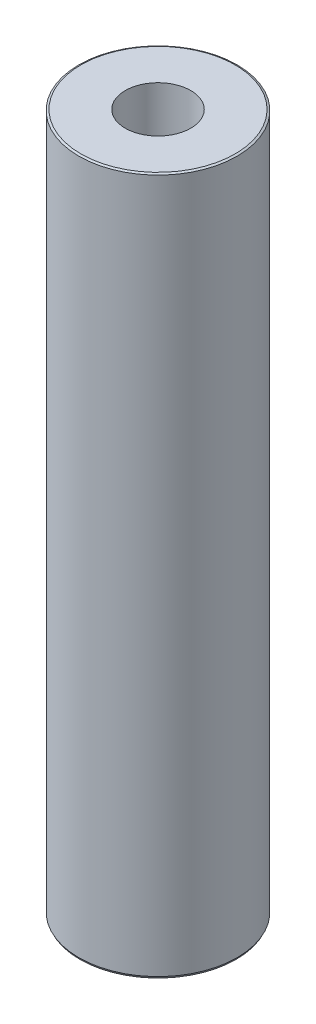
from build123d import *
from OCP.BRepFilletAPI import BRepFilletAPI_MakeChamfer

# Parameters (mm, degrees)
SKETCH1_R           = 45
BOSS_EXTRUDE1_DEPTH = 396.360686705
SKETCH2_R           = 18.602902704
CUT_EXTRUDE1_DEPTH  = 402.437160668
CHAMFER1_SIZE       = 0.553554295
CHAMFER1_SIZE2      = 1.134235657


with BuildPart() as part:
    # Sketch1 → Boss-Extrude1 (new body)
    with BuildSketch(Plane(origin=(0, 0, 0), x_dir=(1, 0, 0), z_dir=(0, 1, 0))):
        Circle(SKETCH1_R)
    extrude(amount=BOSS_EXTRUDE1_DEPTH)

    # Sketch2 → Cut-Extrude1 (cut, through all)
    with BuildSketch(Plane(origin=(0, 0, 0), x_dir=(1, 0, 0), z_dir=(0, 1, 0))):
        Circle(SKETCH2_R)
    extrude(amount=CUT_EXTRUDE1_DEPTH, mode=Mode.SUBTRACT)

    # Chamfer1: one chamfer whose edges measure the first distance from different faces: ONE call of the kernel's chamfer builder (chamfer() names one face for all edges)
    chamfer1_edges_1 = [part.edges().sort_by_distance(p)[0] for p in [
        (-45, 396.360686705, 0),
    ]]
    chamfer1_side_1 = [part.faces().sort_by_distance(p)[0] for p in [
        (-45, 198.180343353, 0),
    ]]
    chamfer1_edges_2 = [part.edges().sort_by_distance(p)[0] for p in [
        (-45, 0, 0),
    ]]
    chamfer1_side_2 = [part.faces().sort_by_distance(p)[0] for p in [
        (-43.727207794, 0, 0),
    ]]
    chamfer1 = BRepFilletAPI_MakeChamfer(part.part.solid().wrapped)
    for e in chamfer1_edges_1:
        chamfer1.Add(CHAMFER1_SIZE, CHAMFER1_SIZE2, e.wrapped, chamfer1_side_1[0].wrapped)  # the first distance lies on this face
    for e in chamfer1_edges_2:
        chamfer1.Add(CHAMFER1_SIZE, CHAMFER1_SIZE2, e.wrapped, chamfer1_side_2[0].wrapped)  # the first distance lies on this face
    add(Compound.cast(chamfer1.Shape()), mode=Mode.REPLACE)


solid = part.part
